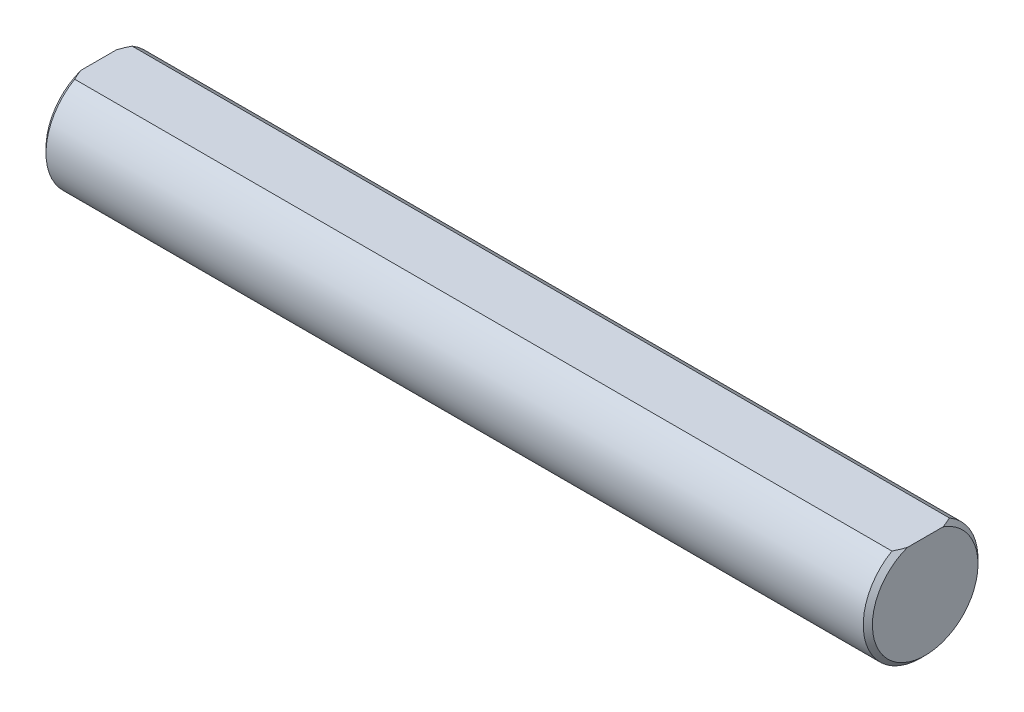
from build123d import *

# Parameters (mm, degrees)
SKETCH1_R           = 3.175
BOSS_EXTRUDE1_DEPTH = 45.72
CHAMFER1_SIZE       = 0.254
CUT_EXTRUDE2_DEPTH  = 46.939957009


with BuildPart() as part:
    # Sketch1 → Boss-Extrude1 (new body)
    with BuildSketch(Plane(origin=(0, 0, 0), x_dir=(0, 0, -1), z_dir=(1, 0, 0))):
        Circle(SKETCH1_R)
    extrude(amount=BOSS_EXTRUDE1_DEPTH)

    # Chamfer1
    chamfer1_edges = [part.edges().sort_by_distance(p)[0] for p in [
        (45.72, 0, 3.175),
        (0, 0, 3.175),
    ]]
    chamfer(chamfer1_edges, length=CHAMFER1_SIZE)

    # Sketch2 → Cut-Extrude2 (cut, through all)
    with BuildSketch(Plane(origin=(45.72, 0, 0), x_dir=(0, 0, -1), z_dir=(1, 0, 0))):
        with BuildLine():
            Line((-1.5875, 2.749630657), (1.5875, 2.749630657))
            ThreePointArc((1.5875, 2.749630657), (0, 3.175), (-1.5875, 2.749630657))
        make_face()
    extrude(amount=-CUT_EXTRUDE2_DEPTH, mode=Mode.SUBTRACT)


solid = part.part
